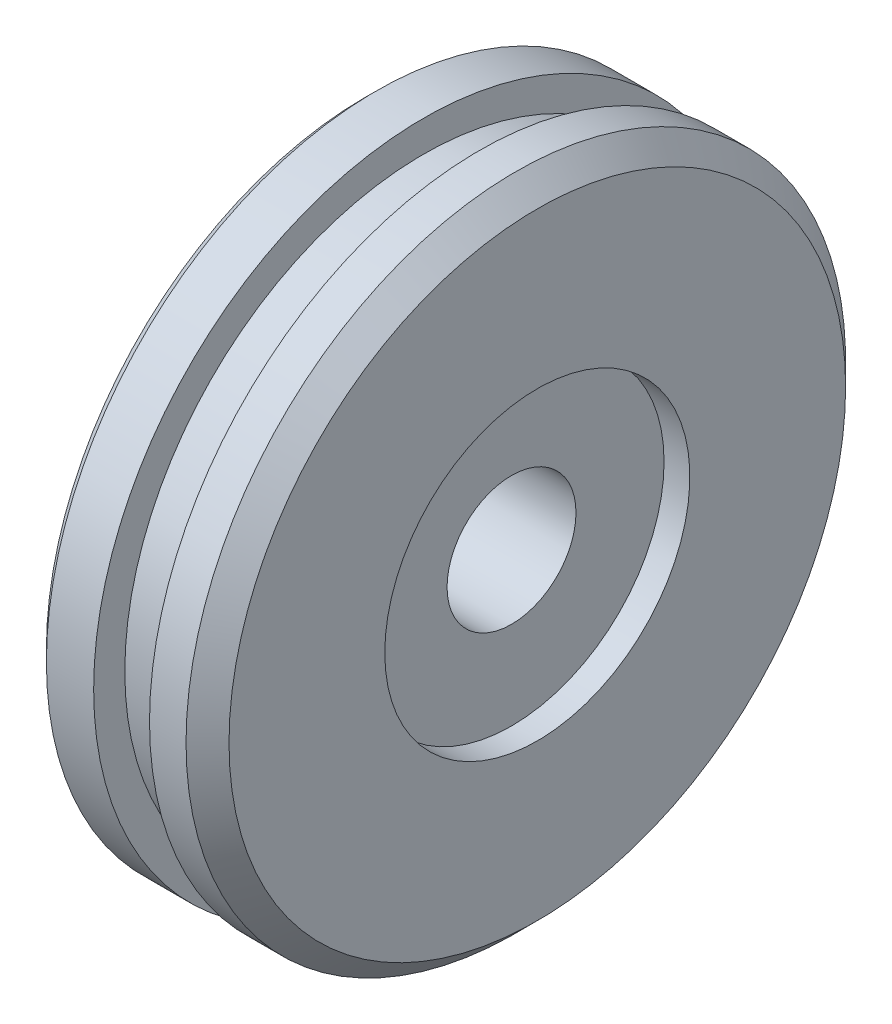
from build123d import *

# Parameters (mm, degrees)
SKETCH2_W            = 2.6
SKETCH2_H            = 2.45
BOSS_EXTRUDE1_START  = -55.3
SKETCH3_W            = 2.3
SKETCH3_H            = 23
BOSS_EXTRUDE1_DEPTH  = 6.6
BOSS_EXTRUDE2_START  = -63.5
SKETCH4_W            = 2.3
SKETCH4_H            = 6.6
BOSS_EXTRUDE2_DEPTH  = 23
BOSS_EXTRUDE3_START  = 76.7
SKETCH5_R            = 4.6
BOSS_EXTRUDE3_DEPTH  = 2.3
BOSS_EXTRUDE4_START  = 84
SKETCH6_R            = 7.1
BOSS_EXTRUDE4_DEPTH  = 1.7
BOSS_EXTRUDE5_START  = 78.9
SKETCH7_R            = 3
BOSS_EXTRUDE5_DEPTH  = 5.2
BOSS_EXTRUDE6_START  = -52.9
SKETCH8_W            = 4.1
SKETCH8_H            = 2.1
BOSS_EXTRUDE6_DEPTH  = 1.8
BOSS_EXTRUDE7_START  = -46.5
SKETCH9_W            = 4.1
SKETCH9_H            = 1.8
BOSS_EXTRUDE7_DEPTH  = 2.1
BOSS_EXTRUDE8_START  = -52.9
SKETCH10_W           = 4.1
SKETCH10_H           = 2.1
BOSS_EXTRUDE8_DEPTH  = 1.8
BOSS_EXTRUDE9_START  = -59.6
SKETCH11_W           = 4.1
SKETCH11_H           = 1.8
BOSS_EXTRUDE9_DEPTH  = 2.1
BOSS_EXTRUDE10_START = -52.9
SKETCH12_W           = 5.3
SKETCH12_H           = 2.4
BOSS_EXTRUDE10_DEPTH = 1.8
BOSS_EXTRUDE11_START = -44.4
SKETCH13_W           = 5.3
SKETCH13_H           = 1.8
BOSS_EXTRUDE11_DEPTH = 2.4
BOSS_EXTRUDE12_START = -52.9
SKETCH14_W           = 5.3
SKETCH14_H           = 2.4
BOSS_EXTRUDE12_DEPTH = 1.8
BOSS_EXTRUDE13_START = -62
SKETCH15_W           = 5.3
SKETCH15_H           = 1.8
BOSS_EXTRUDE13_DEPTH = 2.4


with BuildPart() as part:
    # Sketch1 → Revolve1 (revolve)
    with BuildSketch(Plane.XY.offset(-52)):
        Polygon((77.2, -65), (85.2, -65), (85.2, -50.65), (84.2, -49.65), (77.7, -49.65), (77.2, -50.15), align=None)
    revolve(axis=Axis((72.2, -65, -52), (1, 0, 0)))


with BuildPart() as body_2:
    # Sketch2 → Revolve2 (revolve)
    with BuildSketch(Plane.XY.offset(-52)):
        with Locations((81.2, -49.875)):
            Rectangle(SKETCH2_W, SKETCH2_H)
    revolve(axis=Axis((74.9, -65, -52), (1, 0, 0)))


with BuildPart() as part_1:
    add(part.part)

    # Combine1: cut body 2
    add(body_2.part, mode=Mode.SUBTRACT)


with BuildPart() as body_2_2:
    # Sketch3 → Boss-Extrude1 (new body)
    with BuildSketch(Plane.XY.offset(BOSS_EXTRUDE1_START)):
        with Locations((77.85, -65)):
            Rectangle(SKETCH3_W, SKETCH3_H)
    extrude(amount=BOSS_EXTRUDE1_DEPTH)


with BuildPart() as part_2:
    add(part_1.part)

    # Combine2: cut body 2 2
    add(body_2_2.part, mode=Mode.SUBTRACT)


with BuildPart() as body_2_3:
    # Sketch4 → Boss-Extrude2 (new body)
    with BuildSketch(Plane.XY.offset(BOSS_EXTRUDE2_START)):
        with Locations((77.85, -65)):
            Rectangle(SKETCH4_W, SKETCH4_H)
    extrude(amount=BOSS_EXTRUDE2_DEPTH)


with BuildPart() as part_3:
    add(part_2.part)

    # Combine3: cut body 2 3
    add(body_2_3.part, mode=Mode.SUBTRACT)


with BuildPart() as body_2_4:
    # Sketch5 → Boss-Extrude3 (new body)
    with BuildSketch(Plane(origin=(0, 0, 0), x_dir=(0, 0, -1), z_dir=(1, 0, 0)).offset(BOSS_EXTRUDE3_START)):
        with Locations((52, -65)):
            Circle(SKETCH5_R)
    extrude(amount=BOSS_EXTRUDE3_DEPTH)


with BuildPart() as part_4:
    add(part_3.part)

    # Combine4: cut body 2 4
    add(body_2_4.part, mode=Mode.SUBTRACT)


with BuildPart() as body_2_5:
    # Sketch6 → Boss-Extrude4 (new body)
    with BuildSketch(Plane(origin=(0, 0, 0), x_dir=(0, 0, -1), z_dir=(1, 0, 0)).offset(BOSS_EXTRUDE4_START)):
        with Locations((52, -65)):
            Circle(SKETCH6_R)
    extrude(amount=BOSS_EXTRUDE4_DEPTH)


with BuildPart() as part_5:
    add(part_4.part)

    # Combine5: cut body 2 5
    add(body_2_5.part, mode=Mode.SUBTRACT)


with BuildPart() as body_2_6:
    # Sketch7 → Boss-Extrude5 (new body)
    with BuildSketch(Plane(origin=(0, 0, 0), x_dir=(0, 0, -1), z_dir=(1, 0, 0)).offset(BOSS_EXTRUDE5_START)):
        with Locations((52, -65)):
            Circle(SKETCH7_R)
    extrude(amount=BOSS_EXTRUDE5_DEPTH)


with BuildPart() as part_6:
    add(part_5.part)

    # Combine6: cut body 2 6
    add(body_2_6.part, mode=Mode.SUBTRACT)


with BuildPart() as body_2_7:
    # Sketch8 → Boss-Extrude6 (new body)
    with BuildSketch(Plane.XY.offset(BOSS_EXTRUDE6_START)):
        with Locations((80.95, -58.45)):
            Rectangle(SKETCH8_W, SKETCH8_H)
    extrude(amount=BOSS_EXTRUDE6_DEPTH)


with BuildPart() as part_7:
    add(part_6.part)

    # Combine7: cut body 2 7
    add(body_2_7.part, mode=Mode.SUBTRACT)


with BuildPart() as body_2_8:
    # Sketch9 → Boss-Extrude7 (new body)
    with BuildSketch(Plane.XY.offset(BOSS_EXTRUDE7_START)):
        with Locations((80.95, -65)):
            Rectangle(SKETCH9_W, SKETCH9_H)
    extrude(amount=BOSS_EXTRUDE7_DEPTH)


with BuildPart() as part_8:
    add(part_7.part)

    # Combine8: cut body 2 8
    add(body_2_8.part, mode=Mode.SUBTRACT)


with BuildPart() as body_2_9:
    # Sketch10 → Boss-Extrude8 (new body)
    with BuildSketch(Plane.XY.offset(BOSS_EXTRUDE8_START)):
        with Locations((80.95, -71.55)):
            Rectangle(SKETCH10_W, SKETCH10_H)
    extrude(amount=BOSS_EXTRUDE8_DEPTH)


with BuildPart() as part_9:
    add(part_8.part)

    # Combine9: cut body 2 9
    add(body_2_9.part, mode=Mode.SUBTRACT)


with BuildPart() as body_2_10:
    # Sketch11 → Boss-Extrude9 (new body)
    with BuildSketch(Plane.XY.offset(BOSS_EXTRUDE9_START)):
        with Locations((80.95, -65)):
            Rectangle(SKETCH11_W, SKETCH11_H)
    extrude(amount=BOSS_EXTRUDE9_DEPTH)


with BuildPart() as part_10:
    add(part_9.part)

    # Combine10: cut body 2 10
    add(body_2_10.part, mode=Mode.SUBTRACT)


with BuildPart() as body_2_11:
    # Sketch12 → Boss-Extrude10 (new body)
    with BuildSketch(Plane.XY.offset(BOSS_EXTRUDE10_START)):
        with Locations((81.55, -56.2)):
            Rectangle(SKETCH12_W, SKETCH12_H)
    extrude(amount=BOSS_EXTRUDE10_DEPTH)


with BuildPart() as part_11:
    add(part_10.part)

    # Combine11: cut body 2 11
    add(body_2_11.part, mode=Mode.SUBTRACT)


with BuildPart() as body_2_12:
    # Sketch13 → Boss-Extrude11 (new body)
    with BuildSketch(Plane.XY.offset(BOSS_EXTRUDE11_START)):
        with Locations((81.55, -65)):
            Rectangle(SKETCH13_W, SKETCH13_H)
    extrude(amount=BOSS_EXTRUDE11_DEPTH)


with BuildPart() as part_12:
    add(part_11.part)

    # Combine12: cut body 2 12
    add(body_2_12.part, mode=Mode.SUBTRACT)


with BuildPart() as body_2_13:
    # Sketch14 → Boss-Extrude12 (new body)
    with BuildSketch(Plane.XY.offset(BOSS_EXTRUDE12_START)):
        with Locations((81.55, -73.8)):
            Rectangle(SKETCH14_W, SKETCH14_H)
    extrude(amount=BOSS_EXTRUDE12_DEPTH)


with BuildPart() as part_13:
    add(part_12.part)

    # Combine13: cut body 2 13
    add(body_2_13.part, mode=Mode.SUBTRACT)


with BuildPart() as body_2_14:
    # Sketch15 → Boss-Extrude13 (new body)
    with BuildSketch(Plane.XY.offset(BOSS_EXTRUDE13_START)):
        with Locations((81.55, -65)):
            Rectangle(SKETCH15_W, SKETCH15_H)
    extrude(amount=BOSS_EXTRUDE13_DEPTH)


with BuildPart() as part_14:
    add(part_13.part)

    # Combine14: cut body 2 14
    add(body_2_14.part, mode=Mode.SUBTRACT)


solid = part_14.part
